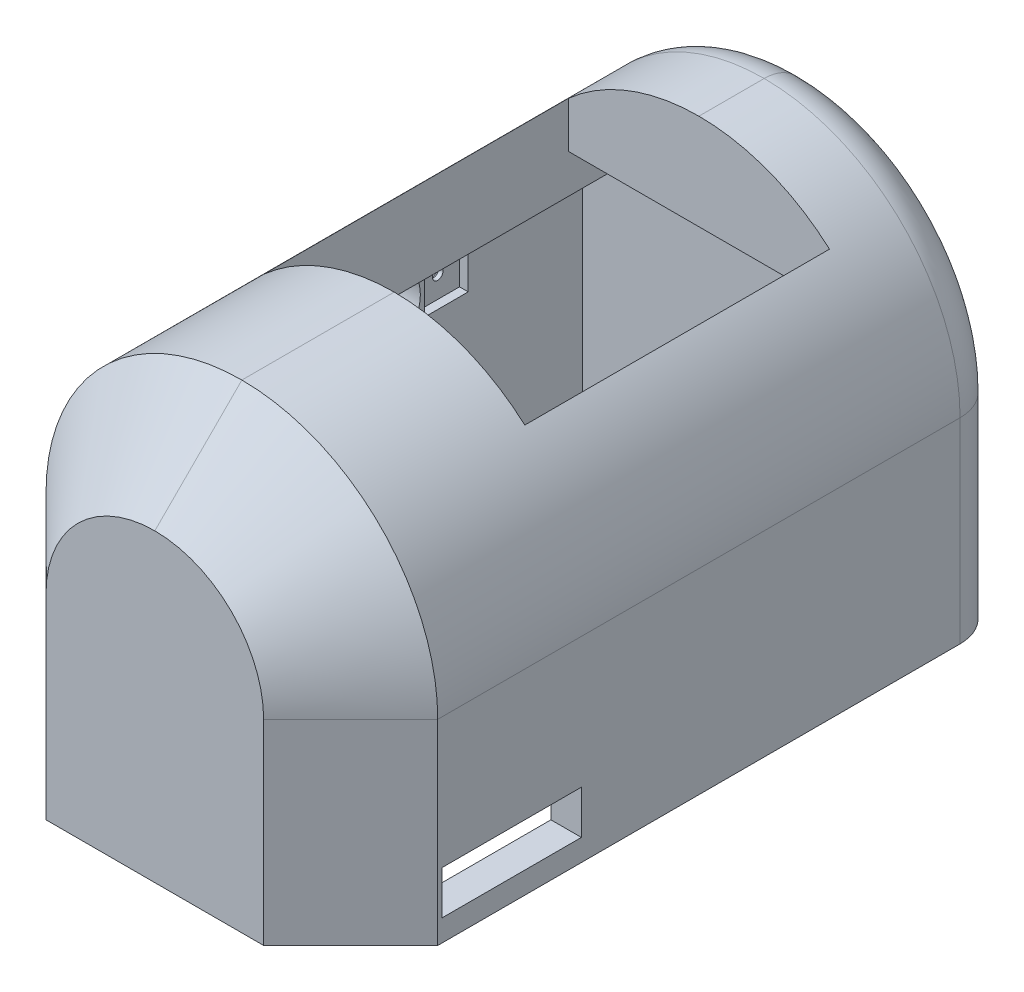
from build123d import *

# Parameters (mm, degrees)
SCHIZZO1_W                             = 90
SCHIZZO1_H                             = 150
ESTRUSIONE_ESTRUSIONE1_DEPTH           = 90
SCHIZZO4_W                             = 60
SCHIZZO4_H                             = 70
TAGLIO_ESTRUSIONE2_DEPTH               = 90
RACCORDO5_R                            = 45
RACCORDO6_R                            = 45
SMUSSO2_SIZE                           = 20
SCHIZZO7_W                             = 50
SCHIZZO7_H                             = 44.753189799
ESTRUSIONE_ESTRUSIONE2_DEPTH           = 50
SMUSSO3_SIZE                           = 20
SMUSSO3_SIZE2                          = 34.641016151
RACCORDO7_R                            = 10
RACCORDO8_R                            = 10
SCHIZZO9_W                             = 50
SCHIZZO9_H                             = 50
ESTRUSIONE_ESTRUSIONE3_DEPTH           = 5
RACCORDO9_R                            = 10
SCHIZZO13_W                            = 45
SCHIZZO13_H                            = 38.415996799
TAGLIO_ESTRUSIONE3_DEPTH               = 79.978264331
SCHIZZO14_W                            = 117.844501366
SCHIZZO14_H                            = 59.041021869
TAGLIO_ESTRUSIONE4_DEPTH               = 8
SCHIZZO18_R                            = 5
TAGLIO_ESTRUSIONE5_DEPTH               = 9
SCHIZZO16_W                            = 4
SCHIZZO16_H                            = 20
TAGLIO_ESTRUSIONE7_DEPTH               = 2
SCHIZZO23_W                            = 76
SCHIZZO23_H                            = 117.844501366
TAGLIO_ESTRUSIONE8_DEPTH               = 38
FORO_PER_VITE_M2_2_D                   = 2.4
FORO_PER_VITE_M2_2_DEPTH               = 4
FORO_PER_VITE_M4_1_D                   = 4.5
FORO_PER_VITE_M4_1_DEPTH               = 10
SCHIZZO29_W                            = 60
SCHIZZO29_H                            = 11.209863528
TAGLIO_ESTRUSIONE9_DEPTH               = 30
SCHIZZO36_W                            = 46.07976418
SCHIZZO36_H                            = 28.262497783
TAGLIO_ESTRUSIONE12_DEPTH              = 28
ESTRUSIONE_ESTRUSIONE4_REACH           = 170.388
SCHIZZO38_R                            = 6
SCHIZZO38_R_2                          = 2.5
TAGLIO_ESTRUSIONE13_DEPTH              = 28
SCHIZZO39_R                            = 9
SCHIZZO39_W                            = 10
SCHIZZO39_H                            = 10
TAGLIO_ESTRUSIONE14_DEPTH              = 2
SCHIZZO40_W                            = 32
SCHIZZO40_H                            = 10
TAGLIO_ESTRUSIONE15_DEPTH              = 10
SCHIZZO42_R                            = 4
TAGLIO_ESTRUSIONE16_DEPTH              = 3
FORO_SVASATO_PER_VITE_M2_3_D           = 2.4
FORO_SVASATO_PER_VITE_M2_3_DEPTH       = 6
FORO_SVASATO_PER_VITE_M2_3_CSINK_D     = 4.4
FORO_SVASATO_PER_VITE_M2_3_CSINK_ANGLE = 90
FORO_SVASATO_PER_VITE_M2_3_TIP         = 0.721032743
SCHIZZO53_R                            = 9
TAGLIO_ESTRUSIONE19_DEPTH              = 2.75
SCHIZZO54_W                            = 60
SCHIZZO54_H                            = 36.634637838
TAGLIO_ESTRUSIONE20_DEPTH              = 24.75
SCHIZZO55_W                            = 50
SCHIZZO55_H                            = 69.198351347
TAGLIO_ESTRUSIONE21_DEPTH              = 66
SCHIZZO57_W                            = 18.365362162
SCHIZZO57_H                            = 38.415996799
ESTRUSIONE_ESTRUSIONE5_DEPTH           = 47
SCHIZZO58_W                            = 7
SCHIZZO58_H                            = 32
ESTRUSIONE_ESTRUSIONE6_DEPTH           = 11


with BuildPart() as part:
    # Schizzo1 → Estrusione-Estrusione1 (new body)
    with BuildSketch(Plane(origin=(0, 0, 0), x_dir=(1, 0, 0), z_dir=(0, 1, 0))):
        Rectangle(SCHIZZO1_W, SCHIZZO1_H)
    extrude(amount=ESTRUSIONE_ESTRUSIONE1_DEPTH)

    # Schizzo4 → Taglio-Estrusione2 (cut)
    with BuildSketch(Plane(origin=(0, 90, 0), x_dir=(1, 0, 0), z_dir=(0, 1, 0))):
        with Locations((0, 15)):
            Rectangle(SCHIZZO4_W, SCHIZZO4_H)
    extrude(amount=-TAGLIO_ESTRUSIONE2_DEPTH, mode=Mode.SUBTRACT)

    # Raccordo5
    # the kernel refuses this fillet: 45 mm, written as the material it takes off along each edge
    with BuildSketch(Plane(origin=(-45, 90, -187.5), x_dir=(0, -1, 0), z_dir=(0, 0, 1))) as raccordo5_piece_1:
        with BuildLine():
            CenterArc((RACCORDO5_R, RACCORDO5_R), RACCORDO5_R, 180, 90)
            Line((0, RACCORDO5_R), (0, 0))
            Line((0, 0), (RACCORDO5_R, 0))
        make_face()
    extrude(amount=375, mode=Mode.SUBTRACT)

    # Raccordo6
    # the kernel refuses this fillet: 45 mm, written as the material it takes off along each edge
    with BuildSketch(Plane(origin=(45, 90, 187.5), x_dir=(0, -1, 0), z_dir=(0, 0, -1))) as raccordo6_piece_1:
        with BuildLine():
            CenterArc((RACCORDO6_R, RACCORDO6_R), RACCORDO6_R, 180, 90)
            Line((0, RACCORDO6_R), (0, 0))
            Line((0, 0), (RACCORDO6_R, 0))
        make_face()
    extrude(amount=375, mode=Mode.SUBTRACT)

    # Smusso2
    smusso2_edges = [part.edges().sort_by_distance(p)[0] for p in [
        (-45, 22.5, 75),
        (0, 90, 75),
        (45, 22.5, 75),
        (0, 90, 75),
    ]]
    chamfer(smusso2_edges, length=SMUSSO2_SIZE)

    # Schizzo7 → Estrusione-Estrusione2 (add)
    with BuildSketch(Plane.XY.offset(75)):
        with Locations((0, 22.3765949)):
            Rectangle(SCHIZZO7_W, SCHIZZO7_H)
    extrude(amount=ESTRUSIONE_ESTRUSIONE2_DEPTH)

    # Smusso3
    smusso3_edges = [part.edges().sort_by_distance(p)[0] for p in [
        (0, 44.753189799, 125),
    ]]
    smusso3_side = [part.faces().sort_by_distance(p)[0] for p in [
        (0, 44.753189799, 100),
    ]]
    chamfer(smusso3_edges, length=SMUSSO3_SIZE, length2=SMUSSO3_SIZE2, reference=smusso3_side[0])

    # Raccordo7
    raccordo7_edges = [part.edges().sort_by_distance(p)[0] for p in [
        (0, 44.753189799, 105),
    ]]
    fillet(raccordo7_edges, radius=RACCORDO7_R)

    # Raccordo8
    raccordo8_edges = [part.edges().sort_by_distance(p)[0] for p in [
        (0, 10.112173648, 125),
    ]]
    fillet(raccordo8_edges, radius=RACCORDO8_R)

    # Schizzo9 → Estrusione-Estrusione3 (add)
    with BuildSketch(Plane.XZ):
        with Locations((0, 100)):
            Rectangle(SCHIZZO9_W, SCHIZZO9_H)
    extrude(amount=ESTRUSIONE_ESTRUSIONE3_DEPTH)

    # Raccordo9
    raccordo9_edges = [part.edges().sort_by_distance(p)[0] for p in [
        (-45, 22.5, -75),
        (0, 90, -75),
        (45, 22.5, -75),
        (0, 90, -75),
    ]]
    fillet(raccordo9_edges, radius=RACCORDO9_R)

    # Schizzo13 → Taglio-Estrusione3 (cut)
    with BuildSketch(Plane(origin=(0, 0, 20), x_dir=(-1, 0, 0), z_dir=(0, 0, -1))):
        with Locations((0, 19.2079984)):
            Rectangle(SCHIZZO13_W, SCHIZZO13_H)
    extrude(amount=-TAGLIO_ESTRUSIONE3_DEPTH, mode=Mode.SUBTRACT)

    # Schizzo14 → Taglio-Estrusione4 (cut)
    with BuildSketch(Plane.ZY.offset(-30)):
        with Locations((-2.287612845, 29.520510935)):
            Rectangle(SCHIZZO14_W, SCHIZZO14_H)
    taglio_estrusione4 = extrude(amount=-TAGLIO_ESTRUSIONE4_DEPTH, mode=Mode.SUBTRACT)

    # Specchia1: Taglio-Estrusione4 across plane
    add(taglio_estrusione4.mirror(Plane(origin=(0, 0, 0), x_dir=(0, 0, 1), z_dir=(1, 0, 0))), mode=Mode.SUBTRACT)

    # Schizzo18 → Taglio-Estrusione5 (cut)
    with BuildSketch(Plane.ZY.offset(-30)):
        with Locations((-15, 48.541019662)):
            Circle(SCHIZZO18_R)
    extrude(amount=-TAGLIO_ESTRUSIONE5_DEPTH, mode=Mode.SUBTRACT)

    # Schizzo16 → Taglio-Estrusione7 (cut)
    with BuildSketch(Plane.XZ.offset(-59.041021869)):
        with Locations((32, -15)):
            Rectangle(SCHIZZO16_W, SCHIZZO16_H)
    extrude(amount=-TAGLIO_ESTRUSIONE7_DEPTH, mode=Mode.SUBTRACT)

    # Schizzo23 → Taglio-Estrusione8 (cut)
    with BuildSketch(Plane.XZ):
        with Locations((0, -2.287612845)):
            Rectangle(SCHIZZO23_W, SCHIZZO23_H)
    extrude(amount=-TAGLIO_ESTRUSIONE8_DEPTH, mode=Mode.SUBTRACT)

    # Foro per Vite M2-2
    with Locations(Plane(origin=(0, 0, 0), x_dir=(-1, 0, 0), z_dir=(0, -1, 0))):
        with Locations((40, 67), (30, -61.514718626), (-30, -61.514718626), (-40, 67), (-41.5, 5), (41.5, 5)):
            Hole(FORO_PER_VITE_M2_2_D / 2, depth=FORO_PER_VITE_M2_2_DEPTH)

    # Foro per Vite M4-1
    with Locations(Plane(origin=(0, -5, 84.779580177), x_dir=(0, 0, -1), z_dir=(0, -1, 0))):
        with Locations((0, 0)):
            Hole(FORO_PER_VITE_M4_1_D / 2, depth=FORO_PER_VITE_M4_1_DEPTH)

    # Schizzo29 → Taglio-Estrusione9 (cut)
    with BuildSketch(Plane.XZ.offset(-38)):
        with Locations((0, -55.604931764)):
            Rectangle(SCHIZZO29_W, SCHIZZO29_H)
    extrude(amount=-TAGLIO_ESTRUSIONE9_DEPTH, mode=Mode.SUBTRACT)

    # Schizzo36 → Taglio-Estrusione12 (cut)
    with BuildSketch(Plane(origin=(0, 56.654631148, 98.128699633), x_dir=(1, 0, 0), z_dir=(0, 0.5000000000000012, 0.8660254037844378))):
        with Locations((0, -35.289606117)):
            Rectangle(SCHIZZO36_W, SCHIZZO36_H)
    extrude(amount=-TAGLIO_ESTRUSIONE12_DEPTH, mode=Mode.SUBTRACT)

    # Schizzo37 → Estrusione-Estrusione4 (add, up to next)
    with BuildSketch(Plane.ZY.offset(-23.03988209), mode=Mode.PRIVATE) as estrusione_estrusione4_sk1:
        Polygon((122.839127138, 13.854915234), (108.707878246, 38.330956288), (106.809101084, 37.234696782), (120.940349975, 12.758655728), align=None)
    estrusione_estrusione4_tool1 = extrude(estrusione_estrusione4_sk1.sketch, amount=ESTRUSIONE_ESTRUSIONE4_REACH, mode=Mode.PRIVATE) - part.part
    add(estrusione_estrusione4_tool1.solids().sort_by_distance((23.039882, 25.544806, 114.824114))[0])

    # Schizzo38 → Taglio-Estrusione13 (cut)
    with BuildSketch(Plane(origin=(0, 56.654631148, 98.128699633), x_dir=(1, 0, 0), z_dir=(0, 0.5000000000000013, 0.8660254037844379))):
        with Locations(Location((-12.5, -35.289606117, 0), (0, 0, 270))):
            Circle(SCHIZZO38_R)
        with Locations(Location((12.5, -35.289606117, 0), (0, 0, 270))):
            Circle(SCHIZZO38_R_2)
    extrude(amount=-TAGLIO_ESTRUSIONE13_DEPTH, mode=Mode.SUBTRACT)

    # Schizzo39 → Taglio-Estrusione14 (cut)
    with BuildSketch(Plane(origin=(-38, 0, 0), x_dir=(0, 0, -1), z_dir=(1, 0, 0))):
        with Locations(Location((15, 48.541019662, 0), (0, 0, 90))):
            Circle(SCHIZZO39_R)
        with Locations((0, 48.541019662)):
            Rectangle(SCHIZZO39_W, SCHIZZO39_H)
        with Locations((30, 48.541019662)):
            Rectangle(SCHIZZO39_W, SCHIZZO39_H)
    extrude(amount=-TAGLIO_ESTRUSIONE14_DEPTH, mode=Mode.SUBTRACT)

    # Schizzo40 → Taglio-Estrusione15 (cut)
    with BuildSketch(Plane.ZY.offset(45)):
        with Locations((38, 10)):
            Rectangle(SCHIZZO40_W, SCHIZZO40_H)
    taglio_estrusione15 = extrude(amount=-TAGLIO_ESTRUSIONE15_DEPTH, mode=Mode.SUBTRACT)

    # Schizzo42 → Taglio-Estrusione16 (cut)
    with BuildSketch(Plane.ZY.offset(45)):
        with Locations((-30, 48.541019662)):
            Circle(SCHIZZO42_R)
        with Locations((0, 48.541019662)):
            Circle(SCHIZZO42_R)
    extrude(amount=-TAGLIO_ESTRUSIONE16_DEPTH, mode=Mode.SUBTRACT)

    # Foro svasato per Vite M2-3
    with Locations(Plane.ZY.offset(42)):
        with Locations((-30, 48.541019662), (0, 48.541019662)):
            CounterSinkHole(FORO_SVASATO_PER_VITE_M2_3_D / 2, FORO_SVASATO_PER_VITE_M2_3_CSINK_D / 2, depth=FORO_SVASATO_PER_VITE_M2_3_DEPTH, counter_sink_angle=FORO_SVASATO_PER_VITE_M2_3_CSINK_ANGLE)
            with Locations((0, 0, -(FORO_SVASATO_PER_VITE_M2_3_DEPTH + FORO_SVASATO_PER_VITE_M2_3_TIP / 2))):  # 118° drill point
                Cone(0, FORO_SVASATO_PER_VITE_M2_3_D / 2, FORO_SVASATO_PER_VITE_M2_3_TIP, mode=Mode.SUBTRACT)

    # Schizzo53 → Taglio-Estrusione19 (cut)
    with BuildSketch(Plane(origin=(-40, 0, 0), x_dir=(0, 0, -1), z_dir=(1, 0, 0))):
        with Locations(Location((15, 48.541019662, 0), (0, 0, 90))):
            Circle(SCHIZZO53_R)
    extrude(amount=-TAGLIO_ESTRUSIONE19_DEPTH, mode=Mode.SUBTRACT)

    # Schizzo54 → Taglio-Estrusione20 (cut)
    with BuildSketch(Plane.XZ.offset(-38)):
        with Locations((0, 38.317318919)):
            Rectangle(SCHIZZO54_W, SCHIZZO54_H)
    extrude(amount=-TAGLIO_ESTRUSIONE20_DEPTH, mode=Mode.SUBTRACT)

    # Schizzo55 → Taglio-Estrusione21 (cut)
    with BuildSketch(Plane(origin=(0, 44.753189799, 0), x_dir=(1, 0, 0), z_dir=(0, 1, 0))):
        with Locations((0, -109.599175673)):
            Rectangle(SCHIZZO55_W, SCHIZZO55_H)
    extrude(amount=-TAGLIO_ESTRUSIONE21_DEPTH, mode=Mode.SUBTRACT)

    # Schizzo57 → Estrusione-Estrusione5 (add)
    with BuildSketch(Plane(origin=(-22.5, 0, 0), x_dir=(0, 0, -1), z_dir=(1, 0, 0))):
        with Locations((-65.817318919, 19.2079984)):
            Rectangle(SCHIZZO57_W, SCHIZZO57_H)
    extrude(amount=ESTRUSIONE_ESTRUSIONE5_DEPTH)

    # Specchia2: Taglio-Estrusione15 across plane
    add(taglio_estrusione15.mirror(Plane(origin=(0, 0, 0), x_dir=(0, 0, 1), z_dir=(1, 0, 0))), mode=Mode.SUBTRACT)

    # Schizzo58 → Estrusione-Estrusione6 (add)
    with BuildSketch(Plane.XZ.offset(-15)):
        with Locations((-41.5, 38)):
            Rectangle(SCHIZZO58_W, SCHIZZO58_H)
    extrude(amount=ESTRUSIONE_ESTRUSIONE6_DEPTH)


solid = part.part
